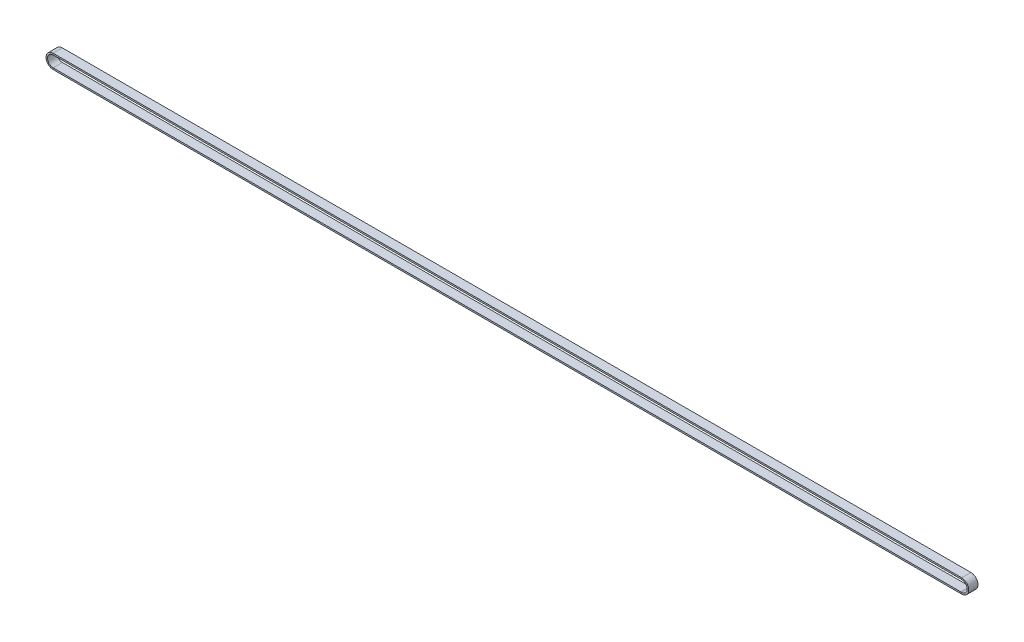
from build123d import *

# Parameters (mm, degrees)
SKETCH3_W = 9
SKETCH3_H = 1.5


with BuildPart() as part:
    # Sweep1: sweep along a path in Sketch2
    with BuildLine(Plane.XY) as sweep1_path:
        Line((1, -48.018109169), (-883.52063792, -48.018109169))
        ThreePointArc((-883.52063792, -48.018109169), (-890.42063792, -41.118109169), (-883.52063792, -34.218109169))
        Line((-883.52063792, -34.218109169), (1, -34.218109169))
        ThreePointArc((1, -34.218109169), (7.9, -41.118109169), (1, -48.018109169))
    # Sketch3 → Sweep1 (sweep)
    with BuildSketch(Plane(origin=(0, 0, 0), x_dir=(0, 0, -1), z_dir=(1, 0, 0))):
        with Locations((-4.5, -47.268109169)):
            Rectangle(SKETCH3_W, SKETCH3_H)
    sweep(path=sweep1_path.line)


solid = part.part
